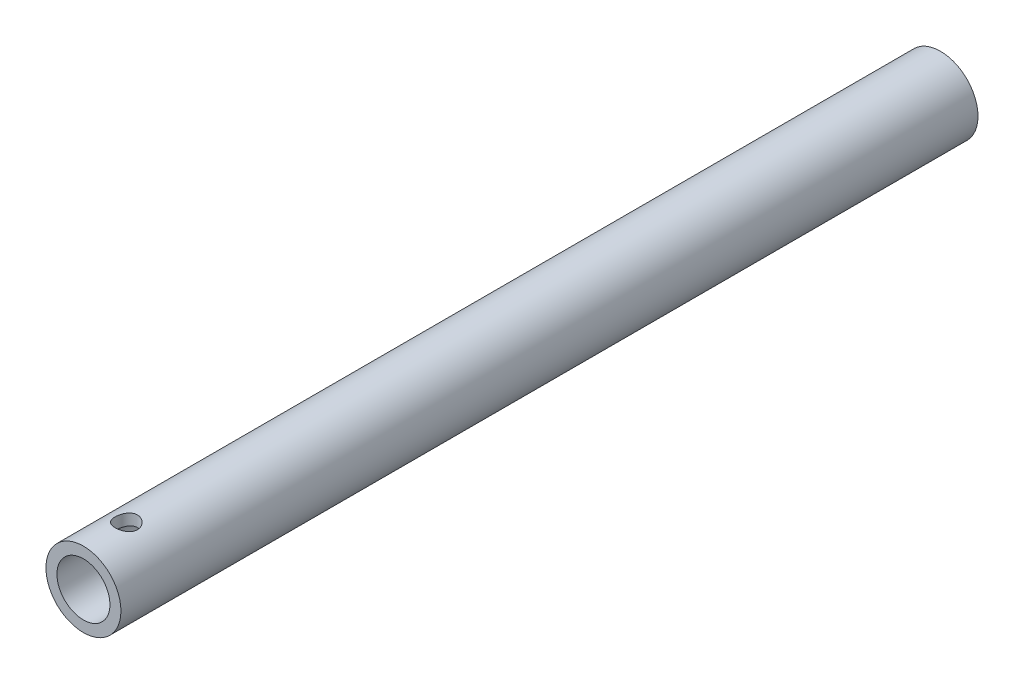
from build123d import *

# Parameters (mm, degrees)
SKETCH1_R               = 13.335
SKETCH1_R_2             = 9.4234
EXTRUDE_THIN1_DEPTH     = 152.4
CUT_EXTRUDE1_DEPTH      = 154.56237967
CUT_EXTRUDE1_DEPTH_BACK = 154.56237967
SKETCH2_R               = 3.96875


with BuildPart() as part:
    # Sketch1 → Extrude-Thin1 (new, symmetric)
    with BuildSketch(Plane.XY):
        Circle(SKETCH1_R)
        Circle(SKETCH1_R_2, mode=Mode.SUBTRACT)
    extrude(amount=EXTRUDE_THIN1_DEPTH, both=True)

    # Sketch2 → Cut-Extrude1 (cut, two sides: drawn at the far end of the back side and taken through both)
    with BuildSketch(Plane(origin=(0, 0, 0), x_dir=(1, 0, 0), z_dir=(0, 1, 0)).offset(-CUT_EXTRUDE1_DEPTH_BACK)):
        with Locations((0, -137.16)):
            Circle(SKETCH2_R)
    extrude(amount=CUT_EXTRUDE1_DEPTH + CUT_EXTRUDE1_DEPTH_BACK, mode=Mode.SUBTRACT)


solid = part.part
